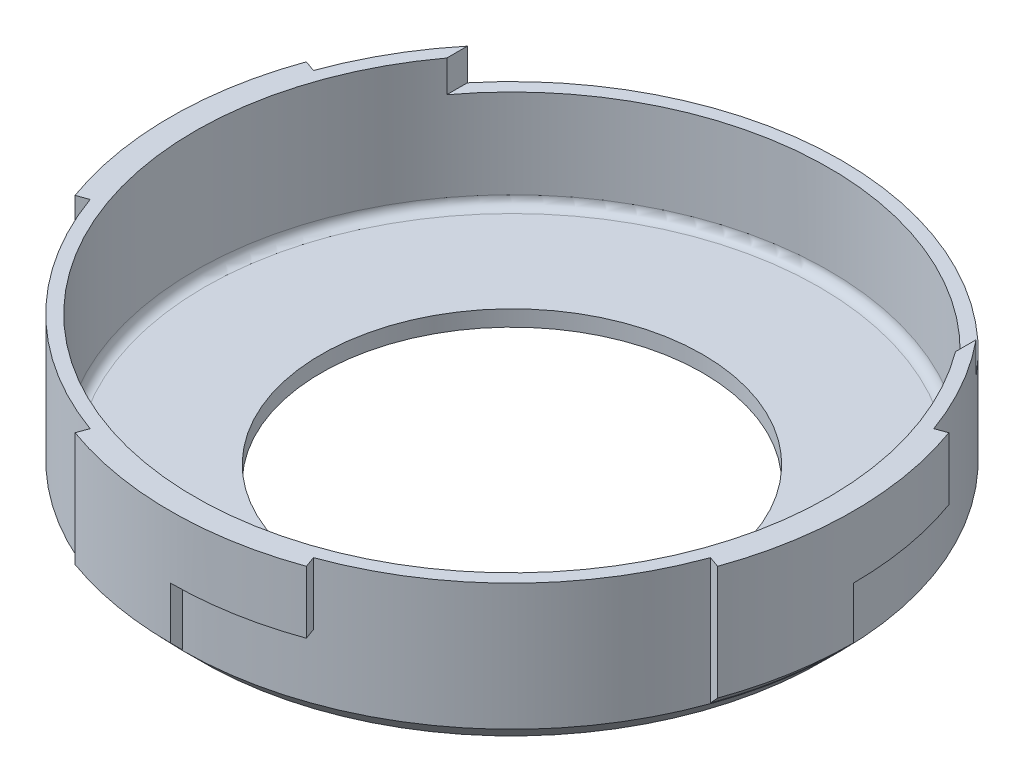
from build123d import *

# Parameters (mm, degrees)
SKETCH1_R           = 51.85
SKETCH1_R_2         = 30
BOSS_EXTRUDE1_DEPTH = 2.5
SKETCH2_R           = 51.85
SKETCH2_R_2         = 49.85
BOSS_EXTRUDE2_DEPTH = 20
SKETCH3_W           = 1.85
SKETCH3_H           = 19.8
REVOLVE1_ANGLE      = 19.8
SKETCH4_W           = 1.85
SKETCH4_H           = 9.8
REVOLVE2_ANGLE      = 19.8
CIRPATTERN1_COUNT   = 3
CIRPATTERN1_ANGLE   = 180
SKETCH5_W           = 80
SKETCH5_H           = 5
CUT_EXTRUDE1_DEPTH  = 80.206249753
BOSS_EXTRUDE3_START = 0.5
SKETCH6_R           = 51.85
SKETCH6_R_2         = 30
BOSS_EXTRUDE3_DEPTH = 0.5
CUT_EXTRUDE2_START  = -0.5
SKETCH7_R           = 49.85
SKETCH7_R_2         = 30
CUT_EXTRUDE2_DEPTH  = 0.5
FILLET1_R           = 1.5
CHAMFER1_SIZE       = 3.1
CHAMFER2_SIZE       = 1.85


with BuildPart() as part:
    # Sketch1 → Boss-Extrude1 (new body)
    with BuildSketch(Plane(origin=(0, 0, 0), x_dir=(1, 0, 0), z_dir=(0, 1, 0))):
        with Locations(Location((0, 0, 0), (0, 0, 270))):
            Circle(SKETCH1_R)
        with Locations(Location((0, 0, 0), (0, 0, 270))):
            Circle(SKETCH1_R_2, mode=Mode.SUBTRACT)
    extrude(amount=BOSS_EXTRUDE1_DEPTH)

    # Sketch2 → Boss-Extrude2 (add)
    with BuildSketch(Plane(origin=(0, 2.5, 0), x_dir=(1, 0, 0), z_dir=(0, 1, 0))):
        with Locations(Location((0, 0, 0), (0, 0, 270))):
            Circle(SKETCH2_R)
        with Locations(Location((0, 0, 0), (0, 0, 270))):
            Circle(SKETCH2_R_2, mode=Mode.SUBTRACT)
    extrude(amount=BOSS_EXTRUDE2_DEPTH)

    # Sketch3 → Revolve1 (revolve)
    with BuildSketch(Plane.XY):
        with Locations((52.775, 12.6)):
            Rectangle(SKETCH3_W, SKETCH3_H)
    revolve1 = revolve(axis=Axis((0, -6.249194118, 0), (0, -1, 0)), revolution_arc=REVOLVE1_ANGLE)

    # Sketch4 → Revolve2 (revolve)
    with BuildSketch(Plane.XY):
        with Locations((52.775, 17.6)):
            Rectangle(SKETCH4_W, SKETCH4_H)
    revolve2 = revolve(axis=Axis((0, 0, 0), (0, 1, 0)), revolution_arc=REVOLVE2_ANGLE)

    # CirPattern1: Revolve1, Revolve2 ×3 about axis
    cirpattern1_axis = Axis((0, 22.5, 0), (0, -1, 0))
    add([revolve1.rotate(cirpattern1_axis, i * CIRPATTERN1_ANGLE / (CIRPATTERN1_COUNT - 1)) for i in range(1, CIRPATTERN1_COUNT)])
    add([revolve2.rotate(cirpattern1_axis, i * CIRPATTERN1_ANGLE / (CIRPATTERN1_COUNT - 1)) for i in range(1, CIRPATTERN1_COUNT)])

    # Sketch5 → Cut-Extrude1 (cut, through all)
    with BuildSketch(Plane.XY):
        with Locations((0, 20)):
            Rectangle(SKETCH5_W, SKETCH5_H)
    extrude(amount=-CUT_EXTRUDE1_DEPTH, mode=Mode.SUBTRACT)

    # Sketch6 → Boss-Extrude3 (add)
    with BuildSketch(Plane.XZ.offset(BOSS_EXTRUDE3_START)):
        with Locations(Location((0, 0, 0), (0, 0, 270))):
            Circle(SKETCH6_R)
        with Locations(Location((0, 0, 0), (0, 0, 270))):
            Circle(SKETCH6_R_2, mode=Mode.SUBTRACT)
    extrude(amount=-BOSS_EXTRUDE3_DEPTH)

    # Sketch7 → Cut-Extrude2 (cut)
    with BuildSketch(Plane(origin=(0, 2.5, 0), x_dir=(1, 0, 0), z_dir=(0, 1, 0)).offset(CUT_EXTRUDE2_START)):
        with Locations(Location((0, 0, 0), (0, 0, 143.360593864))):
            Circle(SKETCH7_R)
        with Locations(Location((0, 0, 0), (0, 0, 90))):
            Circle(SKETCH7_R_2, mode=Mode.SUBTRACT)
    extrude(amount=CUT_EXTRUDE2_DEPTH, mode=Mode.SUBTRACT)

    # Fillet1
    fillet1_edges = [part.edges().sort_by_distance(p)[0] for p in [
        (40, 2, 29.749327724),
    ]]
    fillet(fillet1_edges, radius=FILLET1_R)

    # Chamfer1
    chamfer1_edges = [part.edges().sort_by_distance(p)[0] for p in [
        (0, -0.5, 51.85),
    ]]
    chamfer(chamfer1_edges, length=CHAMFER1_SIZE)

    # Chamfer2
    chamfer2_edges = [part.edges().sort_by_distance(p)[0] for p in [
        (-9.232592685, 2.7, 52.900370815),
        (52.900370815, 2.7, 9.232592685),
        (-52.900370815, 2.7, -9.232592685),
    ]]
    chamfer(chamfer2_edges, length=CHAMFER2_SIZE - 0.0001)  # a hair under: the kernel refuses the full size


solid = part.part
